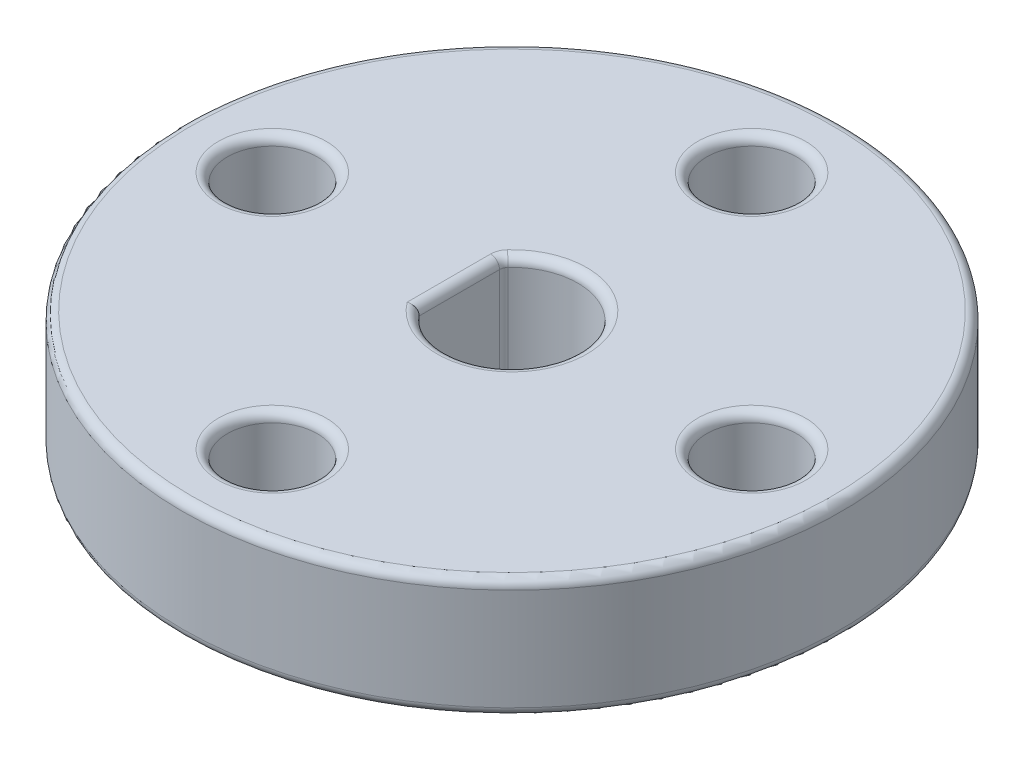
from build123d import *

# Parameters (mm, degrees)
SKETCH1_R           = 11
SKETCH1_R_2         = 1.5
BOSS_EXTRUDE1_DEPTH = 4
FILLET1_R           = 0.3


with BuildPart() as part:
    # Sketch1 → Boss-Extrude1 (new body)
    with BuildSketch(Plane(origin=(0, 0, 0), x_dir=(1, 0, 0), z_dir=(0, 1, 0))):
        Circle(SKETCH1_R)
        with BuildLine():
            Line((-1.7, -1.396424004), (-1.7, 1.396424004))
            ThreePointArc((-1.7, 1.396424004), (2.2, 0), (-1.7, -1.396424004))
        make_face(mode=Mode.SUBTRACT)
        with Locations((-8, 0)):
            Circle(SKETCH1_R_2, mode=Mode.SUBTRACT)
        with Locations((0, -8)):
            Circle(SKETCH1_R_2, mode=Mode.SUBTRACT)
        with Locations((0, 8)):
            Circle(SKETCH1_R_2, mode=Mode.SUBTRACT)
        with Locations((8, 0)):
            Circle(SKETCH1_R_2, mode=Mode.SUBTRACT)
    extrude(amount=BOSS_EXTRUDE1_DEPTH)

    # Fillet1
    fillet1_edges = [part.edges().sort_by_distance(p)[0] for p in [
        (-1.7, 4, 0),
        (-9.5, 0, 0),
        (-1.5, 0, -8),
        (6.5, 0, 0),
        (-1.5, 0, 8),
        (-11, 0, 0),
        (2.2, 0, 0),
        (-1.7, 0, 0),
        (-9.5, 4, 0),
        (-1.5, 4, -8),
        (6.5, 4, 0),
        (-1.5, 4, 8),
        (-11, 4, 0),
        (2.2, 4, 0),
        (-1.7, 2, -1.396424004),
    ]]
    fillet(fillet1_edges, radius=FILLET1_R)


solid = part.part
